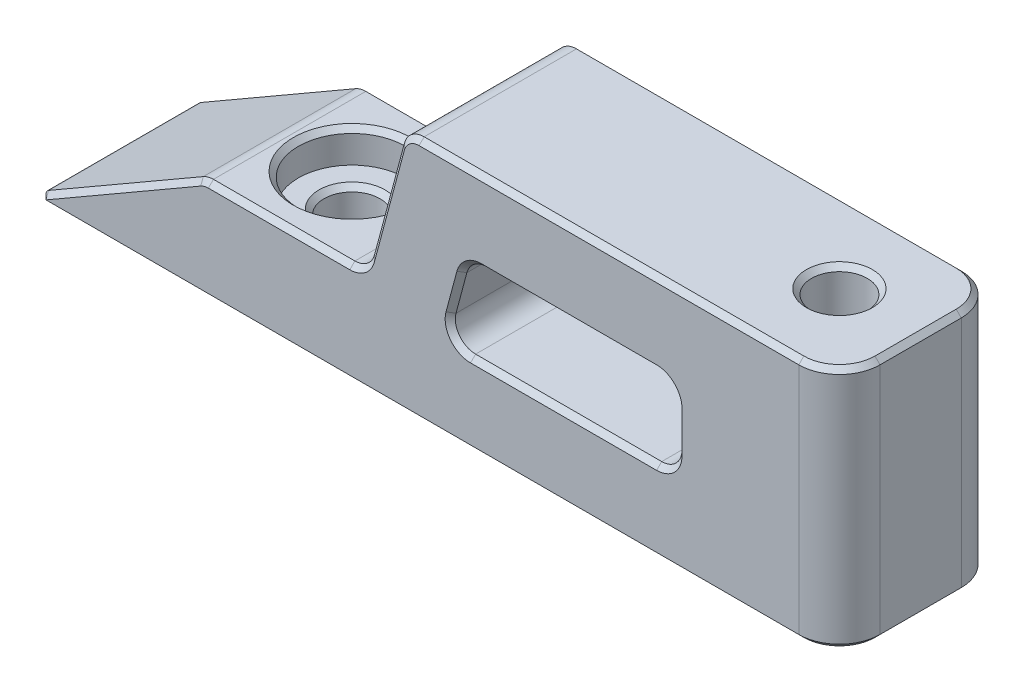
from build123d import *

# Parameters (mm, degrees)
BOSS_EXTRUDE1_DEPTH     = 6.35
CUT_EXTRUDE1_DEPTH      = 38.567106623
CUT_EXTRUDE1_DEPTH_BACK = 38.567106623
SKETCH2_R               = 2.1828125
SKETCH3_R               = 4.191
CUT_EXTRUDE2_DEPTH      = 2.54
FILLET1_R               = 0.396875
FILLET2_R               = 1.5875
FILLET3_R               = 3.175
CHAMFER1_SIZE           = 0.396875


with BuildPart() as part:
    # Sketch1 → Boss-Extrude1 (new, symmetric)
    with BuildSketch(Plane.XY):
        Polygon((-31.75, 0), (31.75, 0), (31.75, 19.05), (-2.324261314, 19.05), (-5.301846715, 7.9375), (-18.001846715, 7.9375), align=None)
        Polygon((19.05, 12.7), (19.05, 6.35), (0.846787688, 6.35), (2.54826506, 12.7), align=None, mode=Mode.SUBTRACT)
    extrude(amount=BOSS_EXTRUDE1_DEPTH, both=True)

    # Sketch2 → Cut-Extrude1 (cut, two sides: drawn at the far end of the back side and taken through both)
    with BuildSketch(Plane.XZ.offset(-CUT_EXTRUDE1_DEPTH_BACK)):
        with Locations(Location((-12.7, 0, 0), (0, 0, 270))):
            Circle(SKETCH2_R)
        with Locations(Location((25.4, 0, 0), (0, 0, 270))):
            Circle(SKETCH2_R)
    extrude(amount=CUT_EXTRUDE1_DEPTH + CUT_EXTRUDE1_DEPTH_BACK, mode=Mode.SUBTRACT)

    # Sketch3 → Cut-Extrude2 (cut)
    with BuildSketch(Plane(origin=(0, 7.9375, 0), x_dir=(1, 0, 0), z_dir=(0, 1, 0))):
        with Locations(Location((-12.7, 0, 0), (0, 0, 180))):
            Circle(SKETCH3_R)
    extrude(amount=-CUT_EXTRUDE2_DEPTH, mode=Mode.SUBTRACT)

    # Fillet1
    fillet1_edges = [part.edges().sort_by_distance(p)[0] for p in [
        (-31.75, 0, 0),
    ]]
    fillet(fillet1_edges, radius=FILLET1_R)

    # Fillet2
    fillet2_edges = [part.edges().sort_by_distance(p)[0] for p in [
        (-18.001846715, 7.9375, 0),
        (-5.301846715, 7.9375, 0),
        (-2.324261314, 19.05, 0),
        (19.05, 12.7, 0),
        (2.54826506, 12.7, 0),
        (0.846787688, 6.35, 0),
        (19.05, 6.35, 0),
    ]]
    fillet(fillet2_edges, radius=FILLET2_R)

    # Fillet3
    fillet3_edges = [part.edges().sort_by_distance(p)[0] for p in [
        (31.75, 9.525, 6.35),
        (31.75, 9.525, -6.35),
    ]]
    fillet(fillet3_edges, radius=FILLET3_R)

    # Chamfer1
    chamfer1_edges = [part.edges().sort_by_distance(p)[0] for p in [
        (31.75, 19.05, 0),
        (31.75, 0, 0),
        (13.73443514, 19.05, -6.35),
        (13.73443514, 19.05, 6.35),
        (30.82006403, 19.05, 5.42006403),
        (30.82006403, 19.05, -5.42006403),
        (30.82006403, 0, 5.42006403),
        (30.82006403, 0, -5.42006403),
        (-12.7, 0, 2.1828125),
        (25.4, 19.05, 2.1828125),
        (25.4, 0, 2.1828125),
        (-8.509, 7.9375, 0),
        (-12.7, 5.3975, 2.1828125),
        (-0.846921168, 0, -6.35),
        (-0.846921168, 0, 6.35),
        (-30.652194148, 0.294156191, -6.35),
        (-30.652194148, 0.294156191, 6.35),
        (-12.04822784, 7.9375, -6.35),
        (-12.04822784, 7.9375, 6.35),
        (-3.813054014, 13.49375, -6.35),
        (-3.813054014, 13.49375, 6.35),
        (-24.418753604, 4.23269708, -6.35),
        (-24.418753604, 4.23269708, 6.35),
        (19.05, 9.525, -6.35),
        (10.614448327, 12.7, -6.35),
        (1.807620061, 9.935875234, -6.35),
        (10.189078984, 6.35, -6.35),
        (-2.072538489, 18.721948428, -6.35),
        (-17.987352606, 7.883407249, -6.35),
        (10.614448327, 12.7, 6.35),
        (19.05, 9.525, 6.35),
        (10.189078984, 6.35, 6.35),
        (1.807620061, 9.935875234, 6.35),
        (-2.072538489, 18.721948428, 6.35),
        (-17.987352606, 7.883407249, 6.35),
        (-5.55356954, 8.265551572, -6.35),
        (-5.55356954, 8.265551572, 6.35),
        (1.656209539, 6.971091231, -6.35),
        (1.656209539, 6.971091231, 6.35),
        (2.799987885, 12.371948428, -6.35),
        (2.799987885, 12.371948428, 6.35),
        (18.585032015, 12.235032015, -6.35),
        (18.585032015, 12.235032015, 6.35),
        (18.585032015, 6.814967985, -6.35),
        (18.585032015, 6.814967985, 6.35),
    ]]
    chamfer(chamfer1_edges, length=CHAMFER1_SIZE - 0.0001)  # a hair under: the kernel refuses the full size


solid = part.part
